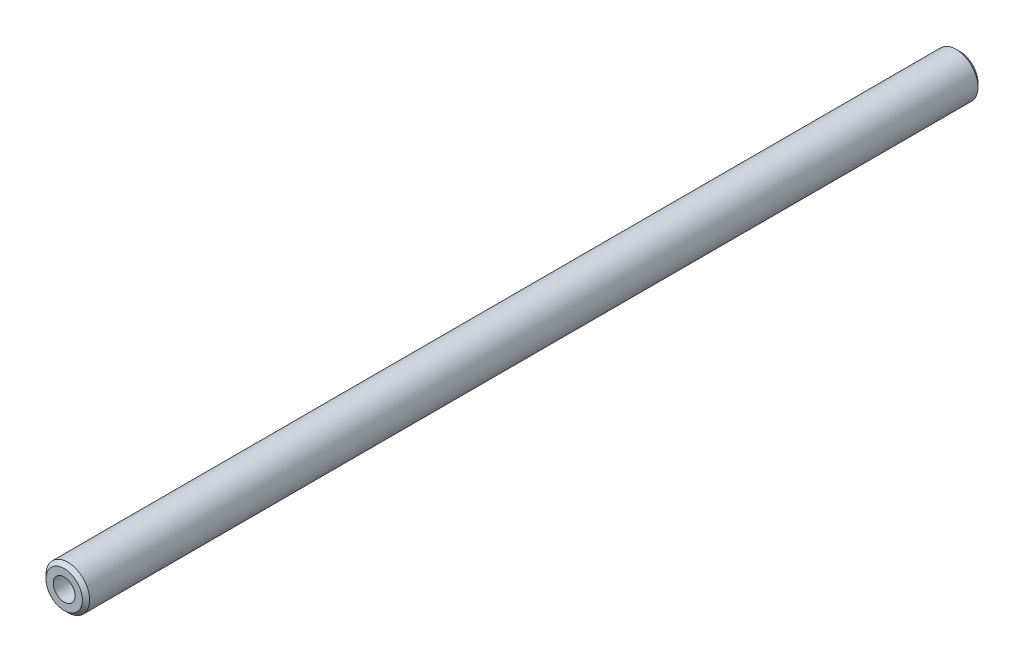
from build123d import *

# Parameters (mm, degrees)
SKETCH_1_R      = 6
SKETCH_1_R_2    = 3
EXTRUDE_1_DEPTH = 246
CHAMFER_1_SIZE  = 1


with BuildPart() as part:
    # 草图1 → 凸台-拉伸1 (new body)
    with BuildSketch(Plane.XY):
        Circle(SKETCH_1_R)
        Circle(SKETCH_1_R_2, mode=Mode.SUBTRACT)
    extrude(amount=EXTRUDE_1_DEPTH)

    # 倒角1
    chamfer_1_edges = [part.edges().sort_by_distance(p)[0] for p in [
        (-6, 0, 246),
        (-6, 0, 0),
    ]]
    chamfer(chamfer_1_edges, length=CHAMFER_1_SIZE)


solid = part.part
